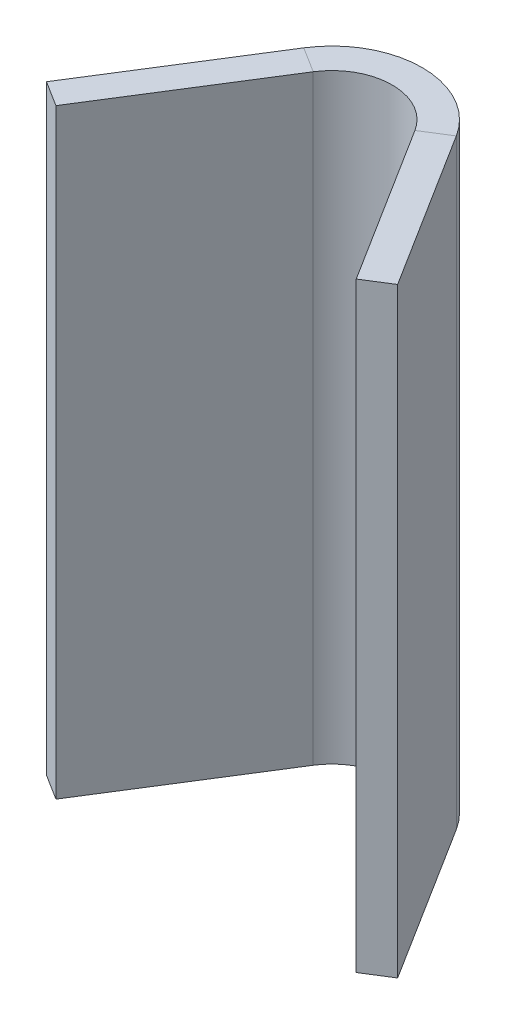
from build123d import *

# Parameters (mm, degrees)
BOSS_EXTRUDE1_DEPTH    = 20
CONVERT_SOLID1_DEPTH   = 20
CONVERT_SOLID1_2_DEPTH = 20


# Read off the part's stored shape, not the designer's step: Convert-Solid1
with BuildPart() as part:
    # Sketch1 → Boss-Extrude1 (new body)
    with BuildSketch(Plane(origin=(0, 0, 0), x_dir=(1, 0, 0), z_dir=(0, 1, 0))):
        Polygon((0, 0), (5, 7.955252718), (10, 0), (11.693315732, 1.064275261), (5, 11.713678895), (-1.693315732, 1.064275261), align=None)
    extrude(amount=BOSS_EXTRUDE1_DEPTH)

    # Convert-Solid1 outline → Convert-Solid1 (cut)
    with BuildSketch(Plane(origin=(0, 0, 0), x_dir=(1, 0, 0), z_dir=(0, 1, 0))):
        with BuildLine():
            Line((5, 7.955252718), (5.503419817, 7.154286344))
            ThreePointArc((5.503419817, 7.154286344), (6.666935225, 6.69108534), (7.539973598, 5.793239432))
            Line((7.539973598, 5.793239432), (10.846657866, 0.53213763))
            Line((10.846657866, 0.53213763), (11.693315732, 1.064275261))
            Line((11.693315732, 1.064275261), (5, 11.713678895))
            Line((5, 11.713678895), (-1.693315732, 1.064275261))
            Line((-1.693315732, 1.064275261), (-0.846657866, 0.53213763))
            Line((-0.846657866, 0.53213763), (2.460026402, 5.793239432))
            ThreePointArc((2.460026402, 5.793239432), (3.333064775, 6.69108534), (4.496580183, 7.154286344))
            Line((4.496580183, 7.154286344), (5, 7.955252718))
        make_face()
    extrude(amount=CONVERT_SOLID1_DEPTH, mode=Mode.SUBTRACT)

    # Convert-Solid1 2 outline → Convert-Solid1 2 (add)
    with BuildSketch(Plane(origin=(0, 0, 0), x_dir=(1, 0, 0), z_dir=(0, 1, 0))):
        with BuildLine():
            ThreePointArc((3.306684268, 5.261101802), (5, 6.196826541), (6.693315732, 5.261101802))
            Line((6.693315732, 5.261101802), (5.503419817, 7.154286344))
            ThreePointArc((5.503419817, 7.154286344), (5, 7.196826541), (4.496580183, 7.154286344))
            Line((4.496580183, 7.154286344), (3.306684268, 5.261101802))
        make_face()
    extrude(amount=CONVERT_SOLID1_2_DEPTH)


solid = part.part
